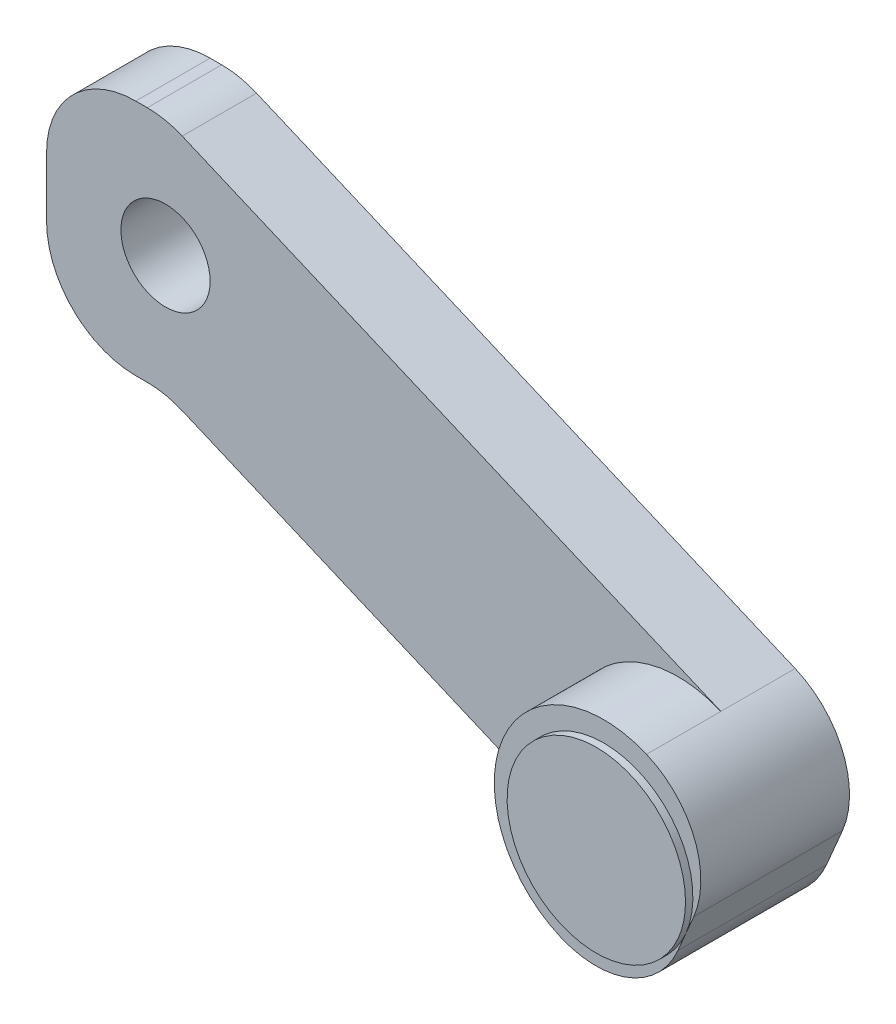
from build123d import *

# Parameters (mm, degrees)
ESBO_O1_R                = 3
RESSALTO_EXTRUS_O1_DEPTH = 5
FILETE1_R                = 6
RESSALTO_EXTRUS_O2_START = 5
RESSALTO_EXTRUS_O2_DEPTH = 5
ESBO_O3_R                = 6
RESSALTO_EXTRUS_O3_DEPTH = 0.5


with BuildPart() as part:
    # Esboço1 → Ressalto-extrusão1 (new body)
    with BuildSketch(Plane.XY):
        Polygon((-8, -8), (-8, 8), (0, 8), (42.879830598, -10.223928004), (37.120169402, -23.776071996), (0, -8), align=None)
        Circle(ESBO_O1_R, mode=Mode.SUBTRACT)
    extrude(amount=RESSALTO_EXTRUS_O1_DEPTH)

    # Filete1
    filete1_edges = [part.edges().sort_by_distance(p)[0] for p in [
        (0, -8, 2.5),
        (-8, -8, 2.5),
        (-8, 8, 2.5),
        (0, 8, 2.5),
        (42.879830598, -10.223928004, 2.5),
        (37.120169402, -23.776071996, 2.5),
    ]]
    fillet(filete1_edges, radius=FILETE1_R)

    # Esboço2 → Ressalto-extrusão2 (add)
    with BuildSketch(Plane.XY.offset(5).offset(RESSALTO_EXTRUS_O2_START)):
        with BuildLine():
            Line((39.467013244, -18.254086485), (40.532986756, -15.745913515))
            ThreePointArc((40.532986756, -15.745913515), (40.575103841, -11.153905468), (37.357845087, -7.877084162))
            ThreePointArc((37.357845087, -7.877084162), (36.552086472, -7.588681558), (35.718304651, -7.395728495))
            ThreePointArc((35.718304651, -7.395728495), (27.413539889, -12.579084175), (31.598183891, -21.429228154))
            ThreePointArc((31.598183891, -21.429228154), (36.190191938, -21.471345238), (39.467013244, -18.254086485))
        make_face()
    extrude(amount=-RESSALTO_EXTRUS_O2_DEPTH)

    # Esboço3 → Ressalto-extrusão3 (add)
    with BuildSketch(Plane.XY.offset(10)):
        with Locations((34.478014489, -14.653156158)):
            Circle(ESBO_O3_R)
    extrude(amount=RESSALTO_EXTRUS_O3_DEPTH)


solid = part.part
